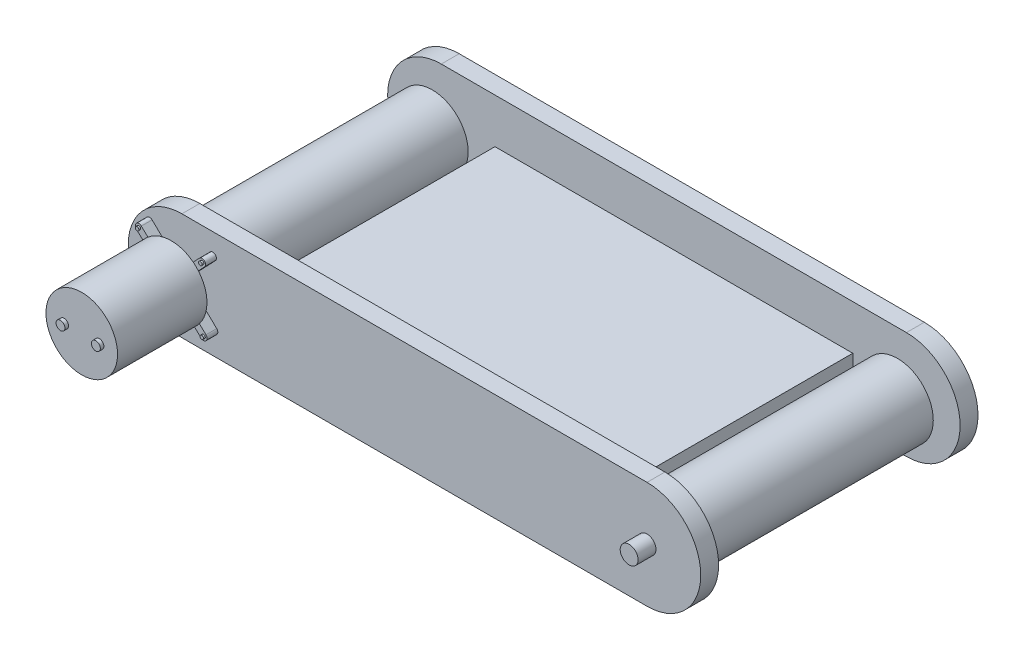
from build123d import *

# Parameters (mm, degrees)
BOSS_EXTRUDE1_DEPTH        = 62.5
BOSS_EXTRUDE1_DEPTH_BACK   = 62.5
SKETCH2_R                  = 20
BOSS_EXTRUDE1_2_DEPTH      = 62.5
BOSS_EXTRUDE1_2_DEPTH_BACK = 62.5
SKETCH4_R                  = 5
BOSS_EXTRUDE5_DEPTH        = 5
SKETCH9_R                  = 5
BOSS_EXTRUDE6_DEPTH        = 25
BOSS_EXTRUDE8_OUTLINE_R    = 5
BOSS_EXTRUDE8_DEPTH        = 10
SKETCH12_W                 = 200
SKETCH12_H                 = 10
BOSS_EXTRUDE9_DEPTH        = 135
SKETCH15_R                 = 5
BOSS_EXTRUDE10_DEPTH       = 6
SKETCH16_R                 = 20
BOSS_EXTRUDE11_DEPTH       = 50
MIRROR6_COPY_1_SKETCH_R    = 5
MIRROR6_COPY_1_DEPTH       = 25
MIRROR6_COPY_2_SKETCH_R    = 5
MIRROR6_COPY_2_DEPTH       = 25
SKETCH17_R                 = 2.5
BOSS_EXTRUDE12_DEPTH       = 2
BOSS_EXTRUDE13_START       = 6
SKETCH18_R                 = 5
BOSS_EXTRUDE13_DEPTH       = 6
SKETCH20_R                 = 1
BOSS_EXTRUDE15_DEPTH       = 1


# Read off the part's stored shape, not the designer's step: Boss-Extrude8
with BuildPart() as part:
    # Sketch2 → Boss-Extrude1 (new, two sides: drawn at the far end of the back side and taken through both)
    with BuildSketch(Plane.XY.offset(-BOSS_EXTRUDE1_DEPTH_BACK)):
        with Locations((-130, 0)):
            Circle(SKETCH2_R)
    extrude(amount=BOSS_EXTRUDE1_DEPTH + BOSS_EXTRUDE1_DEPTH_BACK)

    # Sketch4 → Boss-Extrude5 (add)
    with BuildSketch(Plane.XY.offset(62.5)):
        with Locations((-130, 0)):
            Circle(SKETCH4_R)
    boss_extrude5 = extrude(amount=BOSS_EXTRUDE5_DEPTH)

    # Mirror2: Boss-Extrude5 across plane
    add(boss_extrude5.mirror(Plane.XY))



with BuildPart() as body_2:
    # Sketch2 → Boss-Extrude1 2 (new, two sides: drawn at the far end of the back side and taken through both)
    with BuildSketch(Plane.XY.offset(-BOSS_EXTRUDE1_2_DEPTH_BACK)):
        with Locations((130, 0)):
            Circle(SKETCH2_R)
    extrude(amount=BOSS_EXTRUDE1_2_DEPTH + BOSS_EXTRUDE1_2_DEPTH_BACK)

    # Sketch9 → Boss-Extrude6 (add)
    with BuildSketch(Plane.XY.offset(62.5)):
        with Locations((130, 0)):
            Circle(SKETCH9_R)
    boss_extrude6 = extrude(amount=BOSS_EXTRUDE6_DEPTH)

    # Mirror4: Boss-Extrude6 across plane
    add(boss_extrude6.mirror(Plane.XY))


with BuildPart() as part_1:
    add(part.part)

    add(body_2.part)  # Boss-Extrude8 merges body 2
    # Boss-Extrude8 outline → Boss-Extrude8 (add)
    with BuildSketch(Plane.XY.offset(67.5)):
        with BuildLine():
            ThreePointArc((130, -30), (160, 0), (130, 30))
            Line((130, 30), (-130, 30))
            ThreePointArc((-130, 30), (-160, 0), (-130, -30))
            Line((-130, -30), (130, -30))
        make_face()
        with Locations((130, 0)):
            Circle(BOSS_EXTRUDE8_OUTLINE_R, mode=Mode.SUBTRACT)
    boss_extrude8 = extrude(amount=BOSS_EXTRUDE8_DEPTH)

    # Mirror5: Boss-Extrude8 across plane
    add(boss_extrude8.mirror(Plane.XY))

    # Sketch12 → Boss-Extrude9 (add)
    with BuildSketch(Plane.XY.offset(-67.5)):
        Rectangle(SKETCH12_W, SKETCH12_H)
    extrude(amount=BOSS_EXTRUDE9_DEPTH)

    # Sketch15 → Boss-Extrude10 (add)
    with BuildSketch(Plane.XY.offset(77.5)):
        with Locations((-130, 0)):
            Circle(SKETCH15_R)
    extrude(amount=BOSS_EXTRUDE10_DEPTH)

    # Sketch16 → Boss-Extrude11 (add)
    with BuildSketch(Plane.XY.offset(83.5)):
        with Locations((-130, 0)):
            Circle(SKETCH16_R)
    extrude(amount=BOSS_EXTRUDE11_DEPTH)

    # Mirror6 copy 1 sketch → Mirror6 copy 1 (add)
    with BuildSketch(Plane(origin=(0, 0, -62.5), x_dir=(-1, 0, 0), z_dir=(0, 0, -1))):
        with Locations((130, 0)):
            Circle(MIRROR6_COPY_1_SKETCH_R)
    extrude(amount=MIRROR6_COPY_1_DEPTH)

    # Mirror6 copy 2 sketch → Mirror6 copy 2 (add)
    with BuildSketch(Plane(origin=(0, 0, 62.5), x_dir=(-1, 0, 0), z_dir=(0, 0, 1))):
        with Locations((130, 0)):
            Circle(MIRROR6_COPY_2_SKETCH_R)
    extrude(amount=MIRROR6_COPY_2_DEPTH)

    # Sketch17 → Boss-Extrude12 (add)
    with BuildSketch(Plane.XY.offset(133.5)):
        with Locations((-139.88898439, 0)):
            Circle(SKETCH17_R)
        with Locations((-120.11101561, 0)):
            Circle(SKETCH17_R)
    extrude(amount=BOSS_EXTRUDE12_DEPTH)

    # Sketch18 → Boss-Extrude13 (add)
    with BuildSketch(Plane.XY.offset(77.5).offset(BOSS_EXTRUDE13_START)):
        with BuildLine():
            Line((-133.842725931, 6.440765282), (-146.688296152, 18.721665833))
            ThreePointArc((-146.688296152, 18.721665833), (-149.516009312, 18.658118354), (-149.452461834, 15.830405194))
            Line((-149.452461834, 15.830405194), (-136.606891613, 3.549504643))
            ThreePointArc((-136.606891613, 3.549504643), (-137.498106816, -0.168505698), (-136.440765282, -3.842725931))
            Line((-136.440765282, -3.842725931), (-148.721665833, -16.688296152))
            ThreePointArc((-148.721665833, -16.688296152), (-148.658118354, -19.516009312), (-145.830405194, -19.452461834))
            Line((-145.830405194, -19.452461834), (-133.549504643, -6.606891613))
            ThreePointArc((-133.549504643, -6.606891613), (-129.831494302, -7.498106816), (-126.157274069, -6.440765282))
            Line((-126.157274069, -6.440765282), (-113.311703848, -18.721665833))
            ThreePointArc((-113.311703848, -18.721665833), (-110.483990688, -18.658118354), (-110.547538166, -15.830405194))
            Line((-110.547538166, -15.830405194), (-123.393108387, -3.549504643))
            ThreePointArc((-123.393108387, -3.549504643), (-122.501893184, 0.168505698), (-123.559234718, 3.842725931))
            Line((-123.559234718, 3.842725931), (-111.278334167, 16.688296152))
            ThreePointArc((-111.278334167, 16.688296152), (-111.341881646, 19.516009312), (-114.169594806, 19.452461834))
            Line((-114.169594806, 19.452461834), (-126.450495357, 6.606891613))
            ThreePointArc((-126.450495357, 6.606891613), (-130.168505698, 7.498106816), (-133.842725931, 6.440765282))
        make_face()
        with Locations((-130, 0)):
            Circle(SKETCH18_R, mode=Mode.SUBTRACT)
    extrude(amount=-BOSS_EXTRUDE13_DEPTH)

    # Sketch20 → Boss-Extrude15 (add)
    with BuildSketch(Plane.XY.offset(83.5)):
        with Locations((-148.070378993, 17.276035513)):
            Circle(SKETCH20_R)
        with Locations((-112.723964487, 18.070378993)):
            Circle(SKETCH20_R)
        with Locations((-147.276035513, -18.070378993)):
            Circle(SKETCH20_R)
        with Locations((-111.929621007, -17.276035513)):
            Circle(SKETCH20_R)
    extrude(amount=BOSS_EXTRUDE15_DEPTH)


solid = part_1.part
